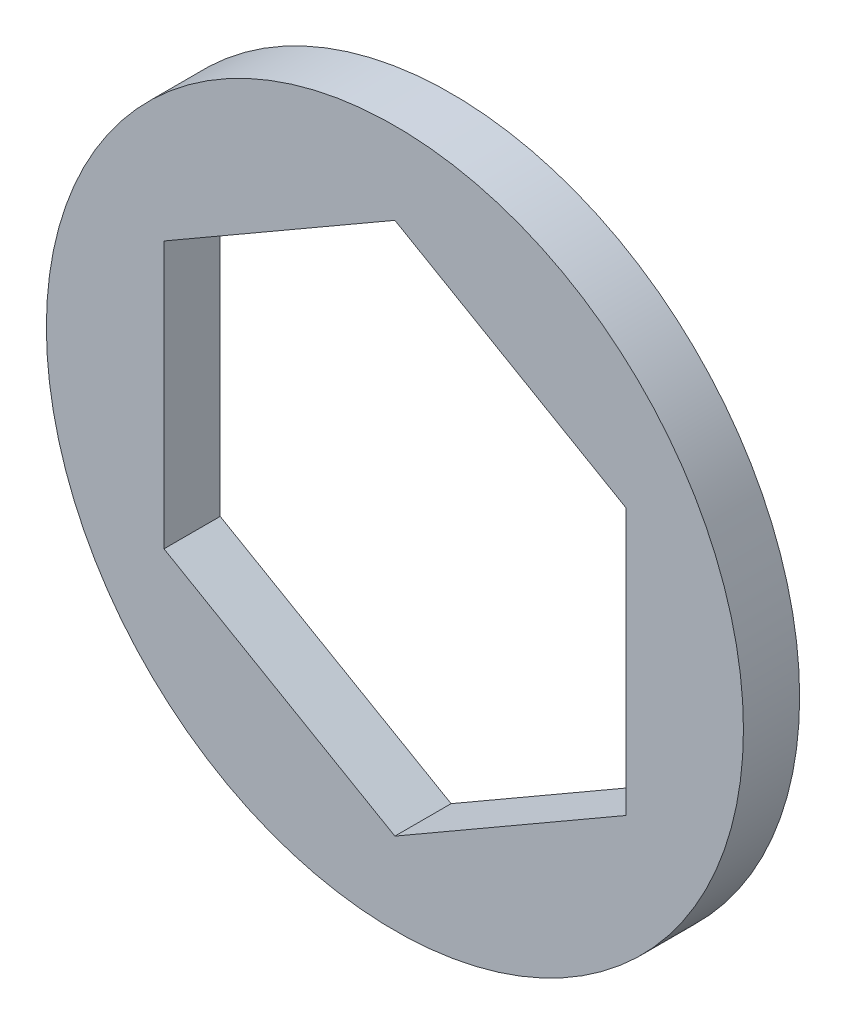
from build123d import *

# Parameters (mm, degrees)
SKETCH1_R           = 10.16
BOSS_EXTRUDE1_DEPTH = 0.81915


with BuildPart() as part:
    # Sketch1 → Boss-Extrude1 (new, symmetric)
    with BuildSketch(Plane.XY):
        Circle(SKETCH1_R)
        Polygon((0, 7.772289324), (-6.731, 3.886144662), (-6.731, -3.886144662), (0, -7.772289324), (6.731, -3.886144662), (6.731, 3.886144662), align=None, mode=Mode.SUBTRACT)
    extrude(amount=BOSS_EXTRUDE1_DEPTH, both=True)


solid = part.part
